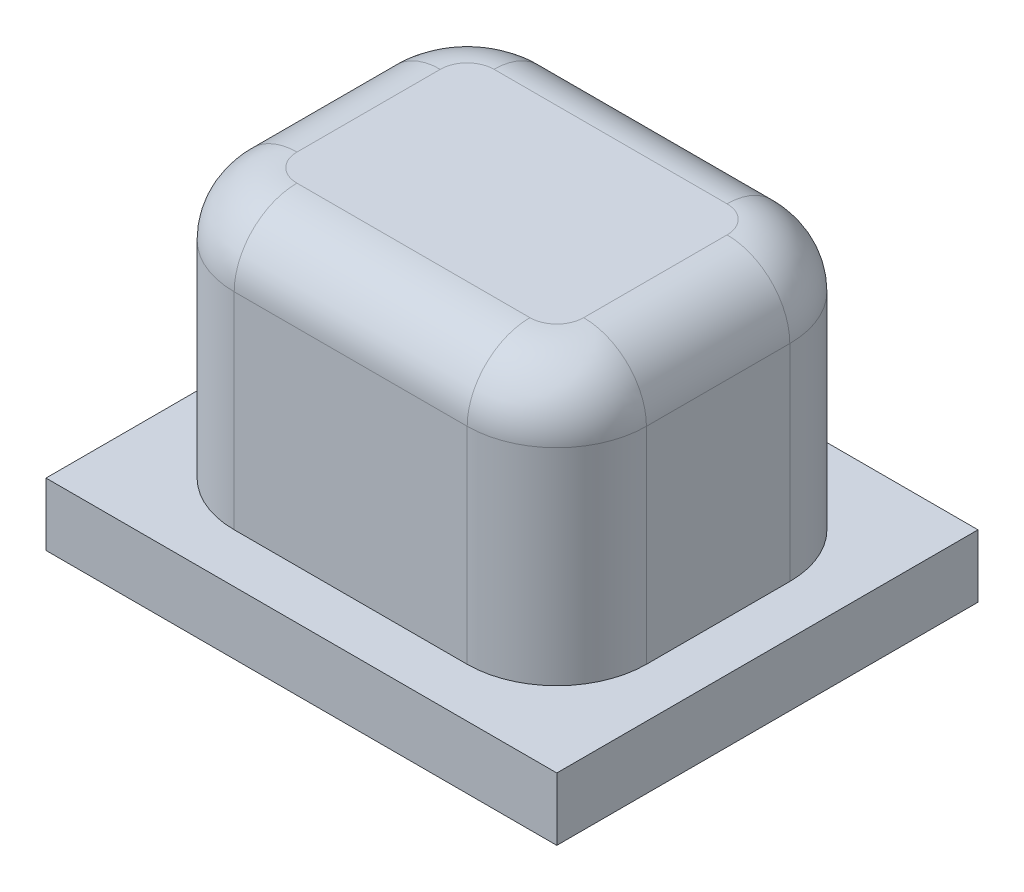
from build123d import *

# Parameters (mm, degrees)
EXTRUDE_335_DEPTH     = 3
SKETCH_2_W            = 5.7
SKETCH_2_H            = 4.7
EXTRUDE_569_DEPTH     = 0.7
SKETCH_3_W            = 3.5
SKETCH_3_H            = 2.5
CUT_EXTRUDE_834_DEPTH = 2.7
FILLET_1_R            = 0.7


with BuildPart() as part:
    # 草图1 → Extrude 335 (new body)
    with BuildSketch(Plane(origin=(0, 0, 0), x_dir=(1, 0, 0), z_dir=(0, 1, 0))):
        with BuildLine():
            Line((-1.3, -1.8), (1.3, -1.8))
            ThreePointArc((1.3, -1.8), (2.007106781, -1.507106781), (2.3, -0.8))
            Line((2.3, -0.8), (2.3, 0.8))
            ThreePointArc((2.3, 0.8), (2.007106781, 1.507106781), (1.3, 1.8))
            Line((1.3, 1.8), (-1.3, 1.8))
            ThreePointArc((-1.3, 1.8), (-2.007106781, 1.507106781), (-2.3, 0.8))
            Line((-2.3, 0.8), (-2.3, -0.8))
            ThreePointArc((-2.3, -0.8), (-2.007106781, -1.507106781), (-1.3, -1.8))
        make_face()
    extrude(amount=EXTRUDE_335_DEPTH)

    # 草图2 → Extrude 569 (add)
    with BuildSketch(Plane.XZ):
        Rectangle(SKETCH_2_W, SKETCH_2_H)
    extrude(amount=EXTRUDE_569_DEPTH)

    # 草图3 → Cut-Extrude 834 (cut)
    with BuildSketch(Plane.XZ.offset(0.7)):
        Rectangle(SKETCH_3_W, SKETCH_3_H)
    extrude(amount=-CUT_EXTRUDE_834_DEPTH, mode=Mode.SUBTRACT)

    # 圆角1
    fillet_1_edges = [part.edges().sort_by_distance(p)[0] for p in [
        (2.007106781, 3, -1.507106781),
        (2.3, 3, 0),
        (2.007106781, 3, 1.507106781),
        (0, 3, 1.8),
        (-2.007106781, 3, 1.507106781),
        (-2.3, 3, 0),
        (-2.007106781, 3, -1.507106781),
        (0, 3, -1.8),
    ]]
    fillet(fillet_1_edges, radius=FILLET_1_R)


solid = part.part
